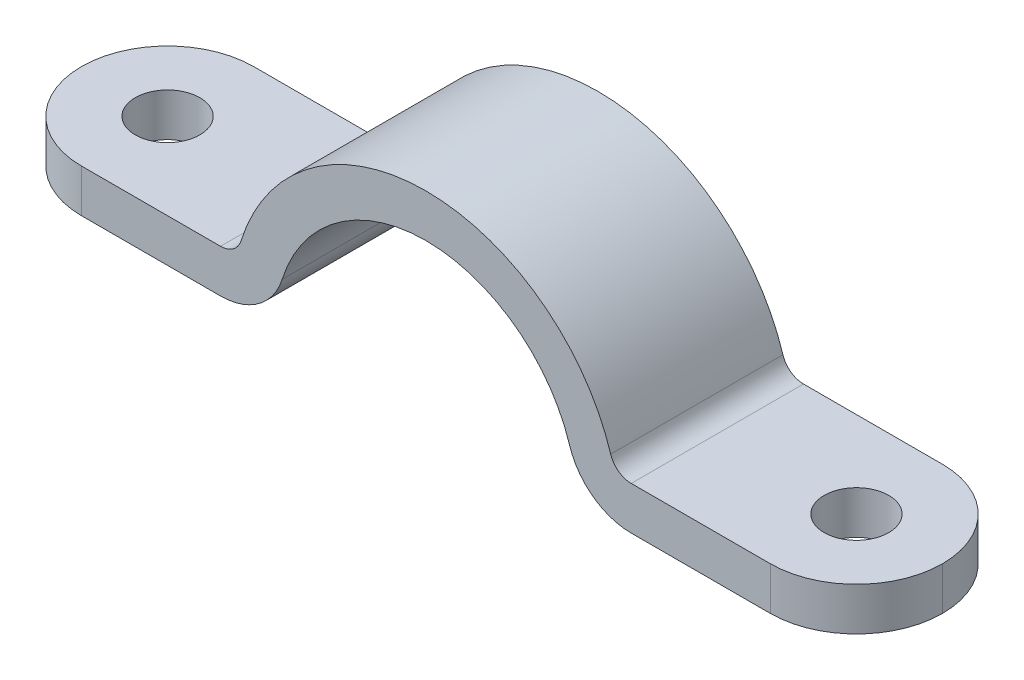
from build123d import *

# Parameters (mm, degrees)
BOSS_EXTRUDE1_DEPTH = 40
FILLET1_R           = 20
SKETCH2_R           = 7.5
CUT_EXTRUDE1_DEPTH  = 114.247516529


with BuildPart() as part:
    # Sketch1 → Boss-Extrude1 (new body)
    with BuildSketch(Plane.XY):
        with BuildLine():
            Line((-100, 0), (-47.696960071, 0))
            ThreePointArc((-47.696960071, 0), (-38.822840396, 2.906613378), (-33.38787205, 10.5))
            ThreePointArc((-33.38787205, 10.5), (0, 35), (33.38787205, 10.5))
            ThreePointArc((33.38787205, 10.5), (38.822840396, 2.906613378), (47.696960071, 0))
            Line((47.696960071, 0), (100, 0))
            Line((100, 0), (100, 10))
            Line((100, 10), (47.696960071, 10))
            ThreePointArc((47.696960071, 10), (44.738920179, 10.968871126), (42.927264064, 13.5))
            ThreePointArc((42.927264064, 13.5), (0, 45), (-42.927264064, 13.5))
            ThreePointArc((-42.927264064, 13.5), (-44.738920179, 10.968871126), (-47.696960071, 10))
            Line((-47.696960071, 10), (-100, 10))
            Line((-100, 10), (-100, 0))
        make_face()
    extrude(amount=BOSS_EXTRUDE1_DEPTH)

    # Fillet1
    fillet1_edges = [part.edges().sort_by_distance(p)[0] for p in [
        (100, 5, 0),
        (100, 5, 40),
        (-100, 5, 0),
        (-100, 5, 40),
    ]]
    fillet(fillet1_edges, radius=FILLET1_R - 0.0001)  # a hair under: the kernel refuses the full size

    # Sketch2 → Cut-Extrude1 (cut, through all)
    with BuildSketch(Plane(origin=(0, 10, 0), x_dir=(1, 0, 0), z_dir=(0, 1, 0))):
        with Locations(Location((-80, -20, 0), (0, 0, 270))):
            Circle(SKETCH2_R)
        with Locations(Location((80, -20, 0), (0, 0, 270))):
            Circle(SKETCH2_R)
    extrude(amount=-CUT_EXTRUDE1_DEPTH, mode=Mode.SUBTRACT)


solid = part.part
